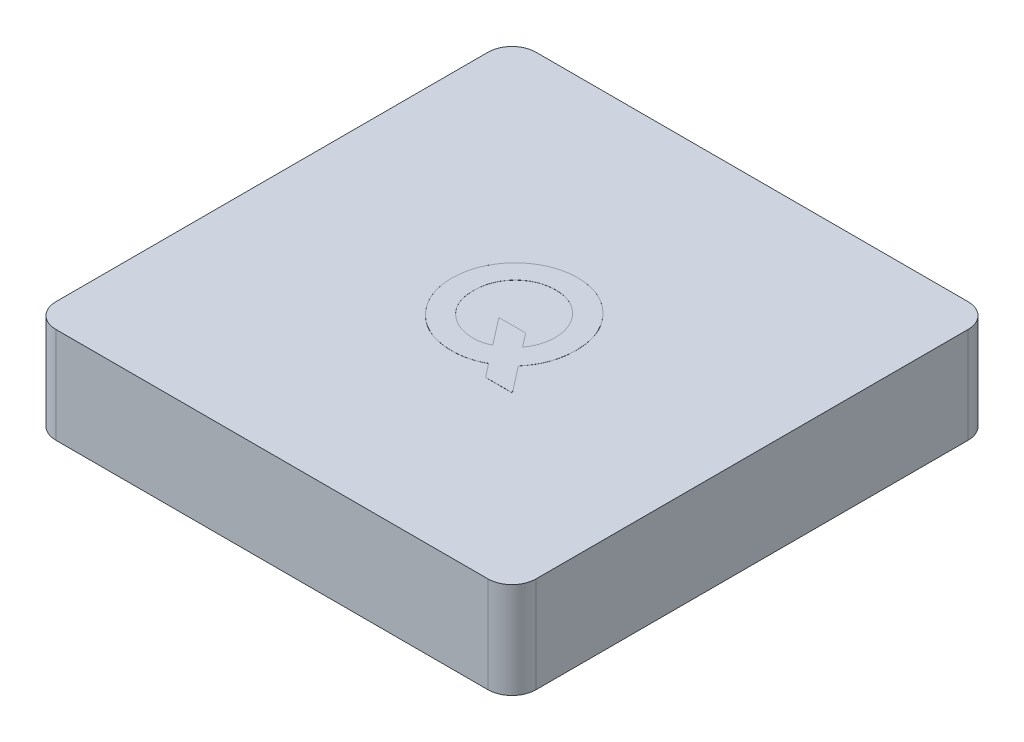
from build123d import *

# Parameters (mm, degrees)
SKETCH1_W           = 12.7
SKETCH1_H           = 12.7
BOSS_EXTRUDE1_DEPTH = 2.54
FILLET1_R           = 0.635
SHELL1_START        = 0.635
SHELL1_OUTLINE_W    = 1.905
SHELL1_OUTLINE_H    = 11.43
SHELL1_DEPTH        = 11.43
SKETCH2_R           = 2.54
BOSS_EXTRUDE2_DEPTH = 1.905
BOSS_EXTRUDE3_DEPTH = 0.00254


# Read off the part's stored shape, not the designer's step: Shell1
with BuildPart() as part:
    # Sketch1 → Boss-Extrude1 (new body)
    with BuildSketch(Plane(origin=(0, 0, 0), x_dir=(1, 0, 0), z_dir=(0, 1, 0))):
        with Locations((6.35, 6.35)):
            Rectangle(SKETCH1_W, SKETCH1_H)
    extrude(amount=BOSS_EXTRUDE1_DEPTH)

    # Fillet1
    fillet1_edges = [part.edges().sort_by_distance(p)[0] for p in [
        (0, 1.27, -12.7),
        (12.7, 1.27, -12.7),
        (12.7, 1.27, 0),
        (0, 1.27, 0),
    ]]
    fillet(fillet1_edges, radius=FILLET1_R)

    # Shell1 outline → Shell1 (cut)
    with BuildSketch(Plane.YZ.offset(SHELL1_START)):
        with Locations((0.9525, -6.35)):
            Rectangle(SHELL1_OUTLINE_W, SHELL1_OUTLINE_H)
    extrude(amount=SHELL1_DEPTH, mode=Mode.SUBTRACT)

    # Sketch2 → Boss-Extrude2 (add)
    with BuildSketch(Plane(origin=(0, 1.905, 0), x_dir=(-1, 0, 0), z_dir=(0, -1, 0))):
        with Locations(Location((-6.35, 6.35, 0), (0, 0, 270))):
            Circle(SKETCH2_R)
    extrude(amount=BOSS_EXTRUDE2_DEPTH)

    # Sketch3 → Boss-Extrude3 (add)
    with BuildSketch(Plane(origin=(0, 2.54, 0), x_dir=(1, 0, 0), z_dir=(0, 1, 0))):
        with BuildLine():
            Line((7.589389744, 5.278208534), (8.128096675, 4.581769231))
            Line((8.128096675, 4.581769231), (7.418937019, 4.581769231))
            Line((7.418937019, 4.581769231), (7.13972528, 4.942391226))
            add(Edge.make_bspline(
                [(7.13972528, 4.942391226), (7.110478697, 4.926466187), (7.052123488, 4.894691228), (6.960614822, 4.855068108), (6.867412166, 4.820307815), (6.771164987, 4.793069664), (6.672797341, 4.771629932), (6.571799543, 4.755260346), (6.468243861, 4.746629027), (6.398354698, 4.745272899), (6.363147756, 4.744589744)],
                knots=[0, 0, 0, 0, 0.985706899, 1.966764212, 2.949968678, 3.929638882, 4.925906056, 5.930211904, 6.957336097, 8, 8, 8, 8], degree=3))
            add(Edge.make_bspline(
                [(6.363147756, 4.744589744), (6.304542849, 4.745905131), (6.189596707, 4.748485098), (6.021255045, 4.773257837), (5.86010189, 4.81065794), (5.706735433, 4.865301405), (5.560639002, 4.93474107), (5.422980515, 5.020794933), (5.292158769, 5.121077116), (5.171374474, 5.236571809), (5.060858729, 5.361731796), (4.96429439, 5.49470483), (4.88220836, 5.633416247), (4.815264882, 5.778083639), (4.763209523, 5.928956411), (4.726755567, 6.085622481), (4.703644343, 6.248298361), (4.700779646, 6.358724268), (4.699325641, 6.414772035)],
                knots=[0, 0, 0, 0, 1.070144486, 2.098953612, 3.10240755, 4.088674545, 5.067611437, 6.052256776, 7.0494179, 8.074208254, 9.100739571, 10.09639475, 11.072322686, 12.041159829, 13.004031207, 13.983083054, 14.976293755, 16, 16, 16, 16], degree=3))
            add(Edge.make_bspline(
                [(4.699325641, 6.414772035), (4.69981035, 6.452327381), (4.700773631, 6.526962536), (4.712359176, 6.637570612), (4.729074707, 6.74600964), (4.753617357, 6.851696745), (4.783880127, 6.95540729), (4.822385353, 7.056316673), (4.867009306, 7.15538311), (4.918202859, 7.251783598), (4.976351833, 7.344092805), (5.03814397, 7.433044208), (5.106877934, 7.51578176), (5.18012093, 7.594168735), (5.258113534, 7.668153791), (5.342084012, 7.736211938), (5.430436693, 7.800032133), (5.523808175, 7.858276403), (5.6205775, 7.910923569), (5.719854021, 7.956677527), (5.820882117, 7.995819583), (5.923699482, 8.027705354), (6.028618864, 8.051600525), (6.134717058, 8.0697941), (6.242956128, 8.079914479), (6.315639078, 8.081572932), (6.352335457, 8.082410256)],
                knots=[0, 0, 0, 0, 1.035855852, 2.058595393, 3.065553363, 4.06176554, 5.050183643, 6.044349766, 7.039272903, 8.046842428, 9.053256483, 10.04817962, 11.033146707, 12.018200652, 13.007259073, 13.996749908, 14.99846043, 16.012935138, 17.03119782, 18.036301871, 19.027088812, 20.018894167, 21.003704893, 21.994284571, 22.987348552, 24, 24, 24, 24], degree=3))
            add(Edge.make_bspline(
                [(6.352335457, 8.082410256), (6.407752886, 8.081001093), (6.516953024, 8.078224334), (6.677585719, 8.054480547), (6.832490656, 8.016657267), (6.981029087, 7.962010037), (7.12410888, 7.893107178), (7.260304055, 7.807850891), (7.391055808, 7.707999288), (7.513539447, 7.593504419), (7.626732359, 7.469249914), (7.725409869, 7.33593868), (7.808946318, 7.196116061), (7.878612035, 7.049726313), (7.931097461, 6.895913898), (7.968565757, 6.735700032), (7.992282098, 6.568971999), (7.995039629, 6.455345392), (7.996441026, 6.397599559)],
                knots=[0, 0, 0, 0, 1.015551519, 2.00114601, 2.970254478, 3.93428303, 4.897362978, 5.876714212, 6.874912676, 7.909046156, 8.946527051, 9.952474942, 10.9443724, 11.928494229, 12.919233427, 13.917651329, 14.941735923, 16, 16, 16, 16], degree=3))
            add(Edge.make_bspline(
                [(7.996441026, 6.397599559), (7.995275963, 6.344324576), (7.992984514, 6.239543185), (7.973133051, 6.085073676), (7.941799009, 5.93618576), (7.89679568, 5.792773627), (7.839764108, 5.654993593), (7.768702598, 5.523255836), (7.686759711, 5.39599636), (7.622008209, 5.317666883), (7.589389744, 5.278208534)],
                knots=[0, 0, 0, 0, 1.049646143, 2.064447078, 3.064298101, 4.044929938, 5.022708814, 5.998521441, 6.991758374, 8, 8, 8, 8], degree=3))
        make_face()
        with BuildLine():
            add(Edge.make_bspline(
                [(7.215411378, 5.762853966), (7.232374671, 5.787174078), (7.265910436, 5.835253985), (7.308344006, 5.911515257), (7.344794922, 5.989262448), (7.374938402, 6.068903528), (7.397868514, 6.150894907), (7.414166719, 6.234701319), (7.424959684, 6.320361144), (7.42602991, 6.378062342), (7.426569231, 6.407139824)],
                knots=[0, 0, 0, 0, 1.031533623, 2.039301536, 3.033003023, 4.018477747, 4.999688364, 5.992485227, 6.988348989, 8, 8, 8, 8], degree=3))
            add(Edge.make_bspline(
                [(7.426569231, 6.407139824), (7.425565467, 6.44492283), (7.423589712, 6.519292914), (7.408750209, 6.628618034), (7.383890189, 6.733390986), (7.349226622, 6.833868214), (7.305573348, 6.930307641), (7.250735612, 7.021906242), (7.186308475, 7.109139766), (7.112913869, 7.191168117), (7.03300641, 7.266242217), (6.948022887, 7.332360438), (6.858546258, 7.388140444), (6.764524178, 7.433179158), (6.666976563, 7.469454645), (6.564856578, 7.493802938), (6.459054311, 7.50976733), (6.386951725, 7.511606706), (6.350427404, 7.512538462)],
                knots=[0, 0, 0, 0, 1.056263418, 2.079093448, 3.078410197, 4.062632158, 5.04680056, 6.032966551, 7.041959893, 8.074807684, 9.106532056, 10.103754224, 11.080880922, 12.048629763, 13.014470275, 13.984975, 14.979267944, 16, 16, 16, 16], degree=3))
            add(Edge.make_bspline(
                [(6.350427404, 7.512538462), (6.312851373, 7.511555352), (6.238893703, 7.509620382), (6.130317465, 7.494494694), (6.026169919, 7.470769489), (5.926998511, 7.435934883), (5.832502968, 7.392042518), (5.742687623, 7.338185734), (5.658002596, 7.274062961), (5.578246545, 7.201552409), (5.506184165, 7.121091877), (5.442548821, 7.034811209), (5.38928769, 6.942918458), (5.344683443, 6.846250439), (5.311105764, 6.743724644), (5.287189539, 6.636142959), (5.272075339, 6.523320349), (5.270170179, 6.446409309), (5.269197436, 6.407139824)],
                knots=[0, 0, 0, 0, 1.042613217, 2.052085894, 3.036973397, 4.002832266, 4.963730975, 5.924467509, 6.903642813, 7.907474205, 8.911719447, 9.896835452, 10.877830278, 11.85475743, 12.846581833, 13.865885605, 14.910357018, 16, 16, 16, 16], degree=3))
            add(Edge.make_bspline(
                [(5.269197436, 6.407139824), (5.270486861, 6.363620201), (5.273013922, 6.278328951), (5.290802543, 6.153911765), (5.321215888, 6.036399284), (5.365204909, 5.926425933), (5.419563509, 5.822443324), (5.488046054, 5.726666097), (5.567678666, 5.637200516), (5.629149275, 5.585123602), (5.660348277, 5.558692308)],
                knots=[0, 0, 0, 0, 1.078047314, 2.112794111, 3.106520711, 4.077995885, 5.041371964, 6.006121678, 6.988020189, 8, 8, 8, 8], degree=3))
            add(Edge.make_bspline(
                [(5.660348277, 5.558692308), (5.685874998, 5.539126434), (5.73649664, 5.500325655), (5.817588059, 5.451211693), (5.900701996, 5.408546176), (5.986624335, 5.374435559), (6.075058256, 5.347307518), (6.165984953, 5.328515818), (6.259582038, 5.316554097), (6.32282995, 5.315165288), (6.354879527, 5.314461538)],
                knots=[0, 0, 0, 0, 1.027457745, 2.037535419, 3.025615023, 4.011018129, 4.9886297, 5.978868484, 6.975833209, 8, 8, 8, 8], degree=3))
            add(Edge.make_bspline(
                [(6.354879527, 5.314461538), (6.391651355, 5.315632394), (6.464636665, 5.317956327), (6.57206456, 5.338199851), (6.676734184, 5.368474506), (6.742353753, 5.399420844), (6.775287179, 5.414952324)],
                knots=[0, 0, 0, 0, 1.010952568, 2.006554787, 2.999521277, 4, 4, 4, 4], degree=3))
            Line((6.775287179, 5.414952324), (6.223859896, 6.128564103))
            Line((6.223859896, 6.128564103), (6.933019551, 6.128564103))
            Line((6.933019551, 6.128564103), (7.215411378, 5.762853966))
        make_face(mode=Mode.SUBTRACT)
    extrude(amount=BOSS_EXTRUDE3_DEPTH)


solid = part.part
